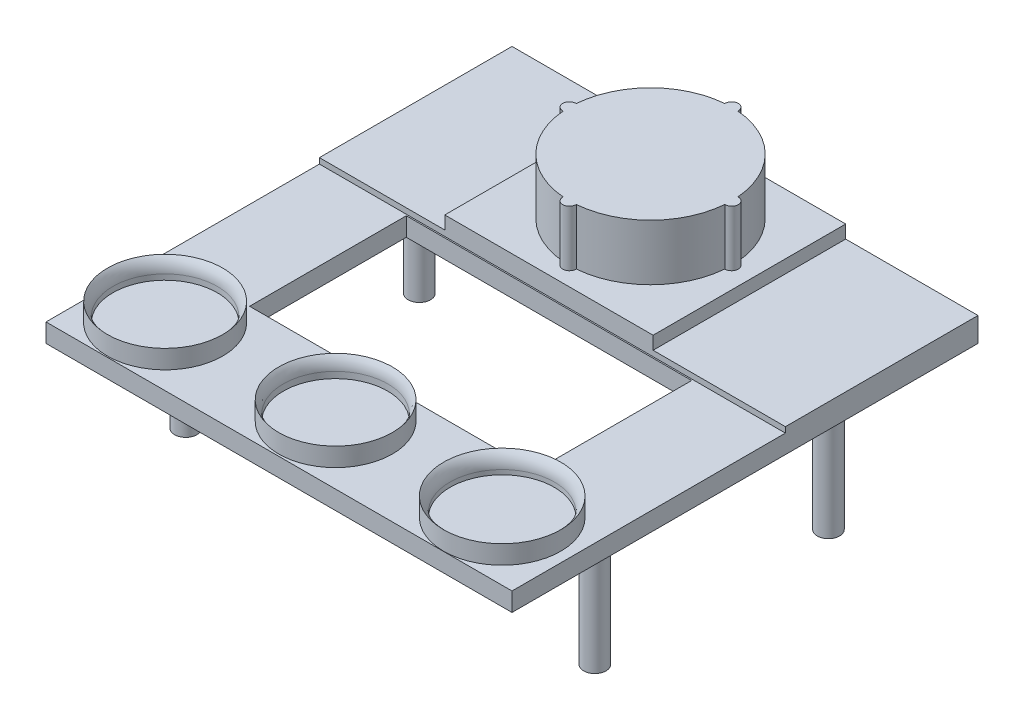
from build123d import *

# Parameters (mm, degrees)
SKETCH_3_W      = 153.07917742657742
SKETCH_3_H      = 84.09905426521841
EXTRUDE_3_DEPTH = 10
SKETCH_4_R      = 5.999999999999998
SKETCH_4_R_2    = 6.000000000000017
SKETCH_4_R_3    = 6
EXTRUDE_4_DEPTH = 65
SKETCH_5_R      = 30.920810944079943
SKETCH_5_R_2    = 27.999999999999996
SKETCH_5_R_3    = 30.50629910833158
SKETCH_5_R_4    = 31.42305288564662
EXTRUDE_5_DEPTH = 10
FILLET_1_R      = 10
SKETCH_6_W      = 249.99999999999997
SKETCH_6_H      = 103.3253548332911
EXTRUDE_6_DEPTH = 3
SKETCH_7_W      = 111.7598891408415
SKETCH_7_H      = 103.3253548332911
EXTRUDE_7_DEPTH = 20
EXTRUDE_8_DEPTH = 30


with BuildPart() as part:
    # 草图3 → 凸台-拉伸3 (new body)
    with BuildSketch(Plane(origin=(0, 0, 0), x_dir=(1, 0, 0), z_dir=(0, 1, 0))):
        Polygon((0, 0), (249.99999999999997, 0), (249.99999999999997, -249.99999999999997), (3.062e-14, -249.99999999999997), align=None)
        with Locations((123.87065697506361, -146.07290630710244)):
            Rectangle(SKETCH_3_W, SKETCH_3_H, mode=Mode.SUBTRACT)
    extrude(amount=EXTRUDE_3_DEPTH)

    # 草图4 → 凸台-拉伸4 (add)
    with BuildSketch(Plane(origin=(0, 0, 0), x_dir=(1, 0, 0), z_dir=(0, 1, 0))):
        with Locations(Location((11.90907445269146, -61.60166288737722, 0), (0, 0, 270))):
            Circle(SKETCH_4_R)
        with Locations(Location((231.3648567656165, -61.60166288737722, 0), (0, 0, 270))):
            Circle(SKETCH_4_R_2)
        with Locations(Location((231.3648567656165, -186.93529856387, 0), (0, 0, 270))):
            Circle(SKETCH_4_R_2)
        with Locations(Location((11.90907445269146, -186.93529856387, 0), (0, 0, 270))):
            Circle(SKETCH_4_R_3)
    extrude(amount=-EXTRUDE_4_DEPTH)

    # 草图5 → 凸台-拉伸5 (add)
    # profile 1 of 3: a face of its own
    with BuildSketch(Plane(origin=(0, 10, 0), x_dir=(1, 0, 0), z_dir=(0, 1, 0))):
        with Locations(Location((32.374758545393455, -218.47190728143076, 0), (0, 0, 270))):
            Circle(SKETCH_5_R)
        with Locations(Location((32.374758545393455, -218.47190728143076, 0), (0, 0, 270))):
            Circle(SKETCH_5_R_2, mode=Mode.SUBTRACT)
    # profile 2 of 3: a face of its own
    with BuildSketch(Plane(origin=(0, 10, 0), x_dir=(1, 0, 0), z_dir=(0, 1, 0))):
        with Locations(Location((123.8146678424456, -218.47190728143076, 0), (0, 0, 84.187846026))):
            Circle(SKETCH_5_R_3)
        with Locations(Location((123.8146678424456, -218.47190728143076, 0), (0, 0, 270))):
            Circle(SKETCH_5_R_2, mode=Mode.SUBTRACT)
    # profile 3 of 3: a face of its own
    with BuildSketch(Plane(origin=(0, 10, 0), x_dir=(1, 0, 0), z_dir=(0, 1, 0))):
        with Locations(Location((213.22257915511878, -218.47190728143076, 0), (0, 0, 270))):
            Circle(SKETCH_5_R_4)
        with Locations(Location((213.22257915511878, -218.47190728143076, 0), (0, 0, 270))):
            Circle(SKETCH_5_R_2, mode=Mode.SUBTRACT)
    extrude(amount=EXTRUDE_5_DEPTH)

    # 圆角1
    # the kernel refuses this fillet: 10 mm, written as the material it takes off along each edge
    with BuildSketch(Plane(origin=(32.374758545393455, 20, 218.47190728143076), x_dir=(-2.5e-16, 0, 1), z_dir=(-1, 0, -2.5e-16))) as fillet_1_piece_1:
        with BuildLine():
            CenterArc((37.99999999999997, -7.062937229690062), FILLET_1_R, 135.06584304394207, 44.93415695605793)
            Line((27.99999999999997, -7.062937229690062), (27.799999999999983, -7.062937229690062))
            Line((27.799999999999983, -7.062937229690062), (27.80000000000001, 0))
            Line((27.80000000000001, 0), (28, 0.1999999999999993))
            ThreePointArc((28, 0.1999999999999993), (29.46040547203998, 0.1999999999999993), (30.77922716296152, 0.14125874459380228))
            Line((30.77922716296152, 0.14125874459380228), (30.920810944079932, 0))
        make_face()
    revolve(axis=Axis((32.374758545393455, 20, 218.47190728143076), (0, 1, 0)), mode=Mode.SUBTRACT)
    with BuildSketch(Plane(origin=(123.8146678424456, 20, 218.47190728143076), x_dir=(0, 0, 1), z_dir=(-1, 0, 0))) as fillet_1_piece_2:
        with BuildLine():
            CenterArc((37.99999999999997, -6.621513946689863), FILLET_1_R, 138.53584249731082, 41.464157502689176)
            Line((27.99999999999997, -6.621513946689863), (27.799999999999983, -6.621513946689863))
            Line((27.799999999999983, -6.621513946689863), (27.80000000000001, 0))
            Line((27.80000000000001, 0), (28, 0.1999999999999993))
            ThreePointArc((28, 0.1999999999999993), (29.253149554165788, 0.1999999999999993), (30.35642509049822, 0.13243027893379278))
            Line((30.35642509049822, 0.13243027893379278), (30.506299108331575, -3.55e-15))
        make_face()
    revolve(axis=Axis((123.8146678424456, 20, 218.47190728143076), (0, 1, 0)), mode=Mode.SUBTRACT)
    with BuildSketch(Plane(origin=(213.22257915511878, 20, 218.47190728143076), x_dir=(0, 0, 1), z_dir=(-1, 0, 0))) as fillet_1_piece_3:
        with BuildLine():
            CenterArc((37.99999999999997, -7.53284585365977), FILLET_1_R, 131.1242944649221, 48.87570553507791)
            Line((27.99999999999997, -7.53284585365977), (27.799999999999983, -7.53284585365977))
            Line((27.799999999999983, -7.53284585365977), (27.80000000000001, 0))
            Line((27.80000000000001, 0), (28, 0.1999999999999993))
            ThreePointArc((28, 0.1999999999999993), (29.711526442823327, 0.1999999999999993), (31.291513943359547, 0.15065691707319573))
            Line((31.291513943359547, 0.15065691707319573), (31.423052885646626, 0))
        make_face()
    revolve(axis=Axis((213.22257915511878, 20, 218.47190728143076), (0, 1, 0)), mode=Mode.SUBTRACT)

    # 草图6 → 凸台-拉伸6 (add)
    with BuildSketch(Plane(origin=(0, 10, 0), x_dir=(1, 0, 0), z_dir=(0, 1, 0))):
        with Locations((124.99999999999999, -51.66267741664555)):
            Rectangle(SKETCH_6_W, SKETCH_6_H)
    extrude(amount=EXTRUDE_6_DEPTH)

    # 草图7 → 凸台-拉伸7 (add)
    with BuildSketch(Plane(origin=(0, 0, 0), x_dir=(1, 0, 0), z_dir=(0, 1, 0))):
        with Locations((123.13733518098593, -51.66267741664555)):
            Rectangle(SKETCH_7_W, SKETCH_7_H)
    extrude(amount=EXTRUDE_7_DEPTH)

    # 草图8 → 凸台-拉伸8 (add)
    with BuildSketch(Plane(origin=(0, 20, 0), x_dir=(1, 0, 0), z_dir=(0, 1, 0))):
        with BuildLine():
            ThreePointArc((80.76980033741471, -53.36203223162917), (93.36972027799136, -80.59335577239693), (120.60104381875912, -93.19327571297359))
            ThreePointArc((120.60104381875912, -93.19327571297359), (124.13583776377907, -96.87481756004797), (127.670631708799, -93.19327571297359))
            ThreePointArc((127.670631708799, -93.19327571297359), (154.90195524956675, -80.59335577239695), (167.50187519014344, -53.3620322316292))
            ThreePointArc((167.50187519014344, -53.3620322316292), (171.18341703721785, -49.82723828660922), (167.50187519014344, -46.29244434158925))
            ThreePointArc((167.50187519014344, -46.29244434158925), (154.90195524956675, -19.06112080082149), (127.670631708799, -6.461200860244869))
            ThreePointArc((127.670631708799, -6.461200860244869), (124.13583776377907, -2.779659013170473), (120.60104381875912, -6.461200860244869))
            ThreePointArc((120.60104381875912, -6.461200860244869), (93.36972027799136, -19.061120800821513), (80.76980033741471, -46.29244434158928))
            ThreePointArc((80.76980033741471, -46.29244434158928), (77.08825849034031, -49.82723828660922), (80.76980033741471, -53.36203223162917))
        make_face()
    extrude(amount=EXTRUDE_8_DEPTH)


solid = part.part
